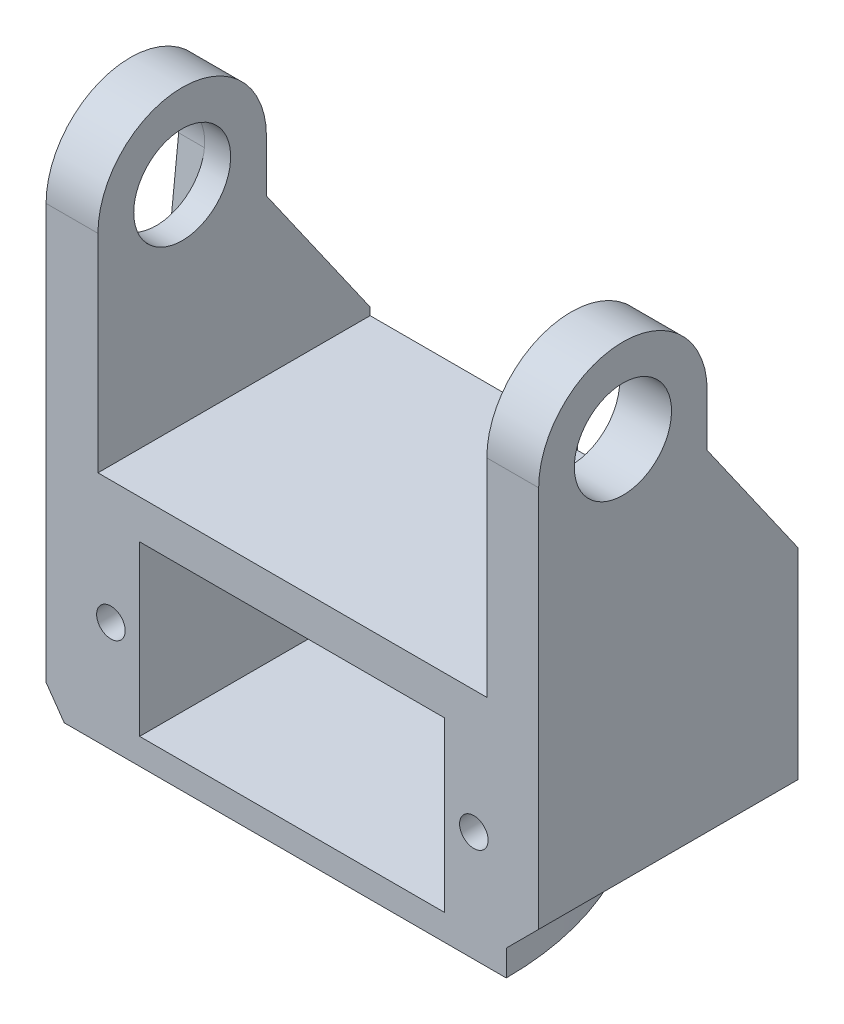
from build123d import *

# Parameters (mm, degrees)
SKETCH_1_R          = 1.1
EXTRUDE_1_DEPTH     = 13
EXTRUDE_2_DEPTH     = 4
CUT_EXTRUDE_1_DEPTH = 2
SKETCH_4_R          = 3.738204999
CUT_EXTRUDE_2_DEPTH = 2
EXTRUDE_4_DEPTH     = 7
CUT_EXTRUDE_START   = -10
SKETCH_9_R          = 3.75
CUT_EXTRUDE_3_DEPTH = 10
SKETCH_10_W         = 20
SKETCH_10_H         = 16
EXTRUDE_5_DEPTH     = 2.25
CHAMFER_1_SIZE      = 2.5
EXTRUDE_8_DEPTH     = 2
CUT_EXTRUDE_4_DEPTH = 1.25
SKETCH_11_R         = 3.6
EXTRUDE_9_DEPTH     = 5.25
SKETCH_15_W         = 17.5
SKETCH_15_H         = 14
EXTRUDE_10_DEPTH    = 1.25
CHAMFER_2_SIZE      = 12
CHAMFER_2_SIZE_2    = 8.402490459
CHAMFER_3_SIZE      = 8.402490459
CHAMFER_3_SIZE_2    = 12
CHAMFER_4_SIZE      = 2
CHAMFER_4_SIZE2     = 1.400415076


with BuildPart() as part:
    # 草图1 → 凸台-拉伸1 (new body)
    with BuildSketch(Plane.XY):
        Polygon((15, 16), (-15, 16), (-15, 32), (-19, 32), (-19, 0), (-11.784120735, 0), (-11.784120735, 13), (11.75, 13), (11.75, 0), (19, 0), (19, 32), (15, 32), align=None)
        with Locations(Location((-14, 6.5, 0), (0, 0, 180))):
            Circle(SKETCH_1_R, mode=Mode.SUBTRACT)
        with Locations(Location((14, 6.5, 0), (0, 0, 180))):
            Circle(SKETCH_1_R, mode=Mode.SUBTRACT)
    extrude(amount=EXTRUDE_1_DEPTH)

    # 草图2 → 凸台-拉伸2 (add)
    with BuildSketch(Plane(origin=(19, 0, 0), x_dir=(0, 0, -1), z_dir=(1, 0, 0))):
        with BuildLine():
            Line((0, 32), (-13, 32))
            ThreePointArc((-13, 32), (-6.5, 38.5), (0, 32))
        make_face()
    extrude_2 = extrude(amount=-EXTRUDE_2_DEPTH)

    # 镜向1: 凸台-拉伸2 across plane
    add(extrude_2.mirror(Plane(origin=(0, 0, 0), x_dir=(0, 0, 1), z_dir=(1, 0, 0))))

    # 草图3 → 切除-拉伸1 (cut)
    with BuildSketch(Plane.ZY.offset(19)):
        with BuildLine():
            Line((2.771151248, 31.602272727), (4.511280666, 15.287878788))
            ThreePointArc((4.511280666, 15.287878788), (6.5, 13.5), (8.488719334, 15.287878788))
            Line((8.488719334, 15.287878788), (10.228848752, 31.602272727))
            ThreePointArc((10.228848752, 31.602272727), (6.5, 35.75), (2.771151248, 31.602272727))
        make_face()
    extrude(amount=-CUT_EXTRUDE_1_DEPTH, mode=Mode.SUBTRACT)

    # 草图4 → 切除-拉伸2 (cut)
    with BuildSketch(Plane.ZY.offset(17)):
        with Locations((6.5, 32)):
            Circle(SKETCH_4_R)
    extrude(amount=-CUT_EXTRUDE_2_DEPTH, mode=Mode.SUBTRACT)

    # 草图5 → 凸台-拉伸4 (add)
    with BuildSketch(Plane(origin=(0, 0, 0), x_dir=(-1, 0, 0), z_dir=(0, 0, -1))):
        Polygon((-19, 16), (19, 16), (19, 0), (16.5, 0), (16.5, 14), (-16.5, 14), (-16.5, 0), (-19, 0), align=None)
    extrude(amount=EXTRUDE_4_DEPTH)

    # 草图9 → 切除-拉伸3 (cut)
    with BuildSketch(Plane(origin=(19, 0, 0), x_dir=(0, 0, -1), z_dir=(1, 0, 0)).offset(CUT_EXTRUDE_START)):
        with Locations(Location((-6.5, 32, 0), (0, 0, 90))):
            Circle(SKETCH_9_R)
    extrude(amount=CUT_EXTRUDE_3_DEPTH, mode=Mode.SUBTRACT)

    # 草图10 → 凸台-拉伸5 (add)
    with BuildSketch(Plane(origin=(0, 0, -7), x_dir=(-1, 0, 0), z_dir=(0, 0, -1))):
        with Locations((9, 8)):
            Rectangle(SKETCH_10_W, SKETCH_10_H)
    extrude(amount=EXTRUDE_5_DEPTH)

    # 倒角1
    chamfer_1_edges = [part.edges().sort_by_distance(p)[0] for p in [
        (19, 0, 3),
    ]]
    chamfer(chamfer_1_edges, length=CHAMFER_1_SIZE)

    # 草图12 → 凸台-拉伸8 (add)
    with BuildSketch(Plane.XZ):
        with BuildLine():
            Line((1, 13), (16.5, 13))
            ThreePointArc((16.5, 13), (12.241770088, -0.55746905), (1, -9.25))
            Line((1, -9.25), (-19, -9.25))
            Line((-19, -9.25), (-19, 13))
            Line((-19, 13), (1, 13))
        make_face()
    extrude(amount=EXTRUDE_8_DEPTH)

    # 草图13 → 切除-拉伸4 (cut)
    with BuildSketch(Plane(origin=(0, 0, -9.25), x_dir=(-1, 0, 0), z_dir=(0, 0, -1))):
        Polygon((19, -2), (19, 16), (-1, 16), (-1, 0), (-1, -2), align=None)
    extrude(amount=-CUT_EXTRUDE_4_DEPTH, mode=Mode.SUBTRACT)

    # 草图11 → 凸台-拉伸9 (add)
    with BuildSketch(Plane.XY.offset(-7)):
        with Locations((-5, 6.5)):
            Circle(SKETCH_11_R)
    extrude(amount=-EXTRUDE_9_DEPTH)

    # 草图15 → 凸台-拉伸10 (add)
    with BuildSketch(Plane.XY.offset(-7)):
        with Locations((-7.75, 7)):
            Rectangle(SKETCH_15_W, SKETCH_15_H)
    extrude(amount=EXTRUDE_10_DEPTH)

    # 倒角2
    # the kernel refuses this chamfer: 12, 8.402490459 mm, written as the material it adds along each edge
    with BuildSketch(Plane(origin=(-15, 16, 0), x_dir=(0, 0.9997533347641299, 0.022209674198457065), z_dir=(-1, 0, 0))) as chamfer_2_piece_1_section:
        Polygon((CHAMFER_2_SIZE * 0.999753334764, CHAMFER_2_SIZE * 0.0222096741985), (-CHAMFER_2_SIZE_2 * 0.0222096741972, CHAMFER_2_SIZE_2 * 0.999753334707), (0, 0), align=None)
    chamfer_2_piece_1 = extrude(amount=4, mode=Mode.PRIVATE)
    chamfer_2_piece_1 = split(chamfer_2_piece_1, bisect_by=Plane(origin=(-17, 20.095500367, -8), z_dir=(0, 0, 1)), keep=Keep.TOP, mode=Mode.PRIVATE)
    add(chamfer_2_piece_1)

    # 倒角3
    # the kernel refuses this chamfer: 12, 8.402490459 mm, written as the material it adds along each edge
    with BuildSketch(Plane(origin=(19, 16, 0), x_dir=(0, -0.045263737714020834, -0.9989750717851553), z_dir=(-1, 0, 0))) as chamfer_3_piece_1_section:
        Polygon((CHAMFER_3_SIZE * 0.998975071728, -CHAMFER_3_SIZE * 0.0452637377114), (-CHAMFER_3_SIZE_2 * 0.045263737714, -CHAMFER_3_SIZE_2 * 0.998975071785), (0, 0), align=None)
    chamfer_3_piece_1 = extrude(amount=4, mode=Mode.PRIVATE)
    chamfer_3_piece_1 = split(chamfer_3_piece_1, bisect_by=Plane(origin=(17, 20.095500367, -7), z_dir=(0, 0, 1)), keep=Keep.TOP, mode=Mode.PRIVATE)
    add(chamfer_3_piece_1)

    # 倒角4
    chamfer_4_edges = [part.edges().sort_by_distance(p)[0] for p in [
        (-19, -2, 2.5),
    ]]
    chamfer_4_side = [part.faces().sort_by_distance(p)[0] for p in [
        (-19, 13.42478673, 3.080992557),
    ]]
    chamfer(chamfer_4_edges, length=CHAMFER_4_SIZE, length2=CHAMFER_4_SIZE2, reference=chamfer_4_side[0])


solid = part.part
